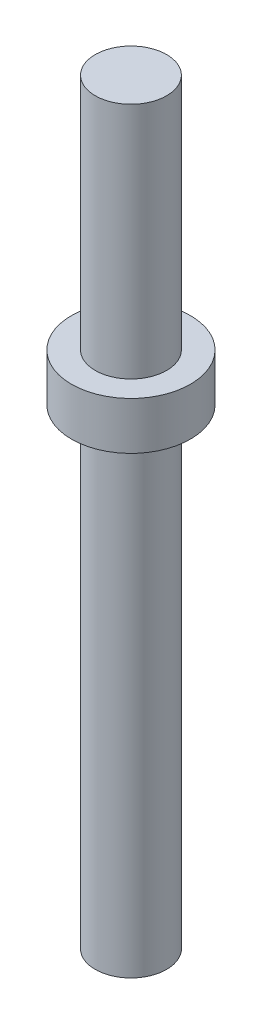
from build123d import *

# Parameters (mm, degrees)
SKETCH1_R           = 1.5
BOSS_EXTRUDE1_DEPTH = 19.8
SKETCH2_R           = 2.5
BOSS_EXTRUDE2_DEPTH = 2
SKETCH3_R           = 1.5
BOSS_EXTRUDE3_DEPTH = 10


with BuildPart() as part:
    # Sketch1 → Boss-Extrude1 (new body)
    with BuildSketch(Plane(origin=(0, 0, 0), x_dir=(1, 0, 0), z_dir=(0, 1, 0))):
        Circle(SKETCH1_R)
    extrude(amount=BOSS_EXTRUDE1_DEPTH)

    # Sketch2 → Boss-Extrude2 (add)
    with BuildSketch(Plane(origin=(0, 19.8, 0), x_dir=(1, 0, 0), z_dir=(0, 1, 0))):
        Circle(SKETCH2_R)
    extrude(amount=BOSS_EXTRUDE2_DEPTH)

    # Sketch3 → Boss-Extrude3 (add)
    with BuildSketch(Plane(origin=(0, 21.8, 0), x_dir=(1, 0, 0), z_dir=(0, 1, 0))):
        Circle(SKETCH3_R)
    extrude(amount=BOSS_EXTRUDE3_DEPTH)


solid = part.part
